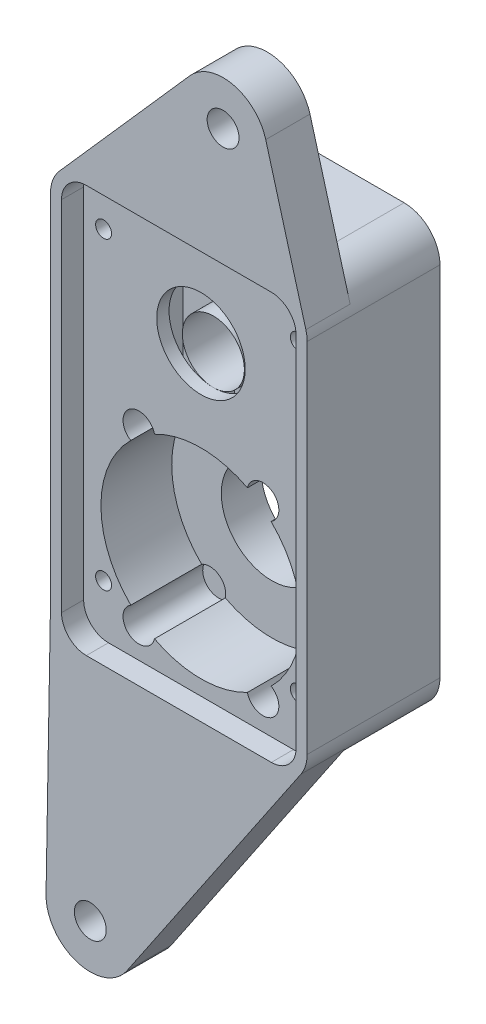
from build123d import *
from build123d.topology import SkipClean

# Parameters (mm, degrees)
SKETCH1_R             = 2.286
SKETCH1_R_2           = 7.239
BOSS_EXTRUDE1_DEPTH   = 6.35
BOSS_EXTRUDE2_START   = 12.7
SKETCH2_R             = 7.239
BOSS_EXTRUDE2_DEPTH   = 12.7
CAVITY1_START         = -6.985
CAVITY1_OUTLINE_R     = 1.143
CAVITY1_OUTLINE_R_2   = 7.239
CAVITY1_OUTLINE_R_3   = 4.445
CAVITY1_DEPTH         = 13.335
CAVITY1_START_2       = 3.175
CAVITY1_2_OUTLINE_R   = 1.143
CAVITY1_2_OUTLINE_R_2 = 4.445
CAVITY1_2_DEPTH       = 3.175
CAVITY1_START_3       = -10.033
CAVITY1_3_OUTLINE_R   = 1.143
CAVITY1_3_OUTLINE_R_2 = 4.445
CAVITY1_3_DEPTH       = 3.048
CAVITY1_START_4       = -12.7
CAVITY1_4_OUTLINE_R   = 1.905
CAVITY1_4_DEPTH       = 3.683
CAVITY1_START_5       = 1.397
CAVITY1_5_DEPTH       = 1.778
CAVITY1_START_6       = -8.255
CAVITY1_6_OUTLINE_R   = 2.286
CAVITY1_6_DEPTH       = 1.27
CAVITY1_START_7       = -10.287
CAVITY1_7_DEPTH       = 0.254


# Read off the part's stored shape, not the designer's step: Cavity1
with BuildPart() as part:
    # Sketch1 → Boss-Extrude1 (new body)
    with BuildSketch(Plane.XY):
        with BuildLine():
            Line((-6.349022038, 0.111441268), (-5.715, 36.232888497))
            Line((-5.715, 36.232888497), (-5.715, 87.540888497))
            ThreePointArc((-5.715, 87.540888497), (-5.382473587, 89.360263498), (-4.427889902, 90.944393921))
            Line((-4.427889902, 90.944393921), (14.289024812, 112.151858549))
            ThreePointArc((14.289024812, 112.151858549), (20.473363243, 114.138419595), (25.168329583, 109.649571449))
            Line((25.168329583, 109.649571449), (30.927346962, 88.917541371))
            ThreePointArc((30.927346962, 88.917541371), (31.067870822, 88.235580298), (31.115, 87.540888497))
            Line((31.115, 87.540888497), (31.115, 36.232888497))
            ThreePointArc((31.115, 36.232888497), (30.889177857, 34.725560815), (30.231540589, 33.350589687))
            Line((30.231540589, 33.350589687), (5.259309369, -3.558393593))
            ThreePointArc((5.259309369, -3.558393593), (-1.914103028, -6.054643639), (-6.349022038, 0.111441268))
        make_face()
        Circle(SKETCH1_R, mode=Mode.SUBTRACT)
        with Locations((19.05, 107.95)):
            Circle(SKETCH1_R, mode=Mode.SUBTRACT)
        with Locations((12.7, 49.186888497)):
            Circle(SKETCH1_R_2, mode=Mode.SUBTRACT)
    extrude(amount=BOSS_EXTRUDE1_DEPTH)

    # Sketch2 → Boss-Extrude2 (add)
    with SkipClean():  # the faces are left unmerged after this step: merging them gives an invalid solid
        with BuildSketch(Plane(origin=(0, 0, 0), x_dir=(-1, 0, 0), z_dir=(0, 0, -1)).offset(BOSS_EXTRUDE2_START)):
            with BuildLine():
                Line((-31.115, 36.232888497), (-31.115, 87.540888497))
                ThreePointArc((-31.115, 87.540888497), (-29.608503729, 91.177892226), (-25.9715, 92.684388497))
                Line((-25.9715, 92.684388497), (0.5715, 92.684388497))
                ThreePointArc((0.5715, 92.684388497), (4.208503729, 91.177892226), (5.715, 87.540888497))
                Line((5.715, 87.540888497), (5.715, 36.232888497))
                ThreePointArc((5.715, 36.232888497), (4.208503729, 32.595884768), (0.5715, 31.089388497))
                Line((0.5715, 31.089388497), (-25.9715, 31.089388497))
                ThreePointArc((-25.9715, 31.089388497), (-29.608503729, 32.595884768), (-31.115, 36.232888497))
            make_face()
            with Locations((-12.7, 49.186888497)):
                Circle(SKETCH2_R, mode=Mode.SUBTRACT)
        extrude(amount=-BOSS_EXTRUDE2_DEPTH)

    # Cavity1 outline → Cavity1 (cut)
    # profile 1 of 6: a face of its own
    with BuildSketch(Plane.XY.offset(CAVITY1_START)):
        with Locations((26.67, 40.042888497)):
            Circle(CAVITY1_OUTLINE_R)
    # profile 2 of 6: a face of its own
    with BuildSketch(Plane.XY.offset(CAVITY1_START)):
        with BuildLine():
            ThreePointArc((22.764128852, 38.956320993), (27.051, 49.186888497), (22.764128852, 59.417456))
            ThreePointArc((22.764128852, 59.417456), (22.936847552, 63.225993711), (19.363505747, 61.897077015))
            ThreePointArc((19.363505747, 61.897077015), (12.7, 63.537888497), (6.036494253, 61.897077015))
            ThreePointArc((6.036494253, 61.897077015), (2.463152448, 63.225993711), (2.635871148, 59.417456))
            ThreePointArc((2.635871148, 59.417456), (-1.651, 49.186888497), (2.635871148, 38.956320993))
            ThreePointArc((2.635871148, 38.956320993), (2.463152448, 35.147783283), (6.036494253, 36.476699979))
            ThreePointArc((6.036494253, 36.476699979), (12.7, 34.835888497), (19.363505747, 36.476699979))
            ThreePointArc((19.363505747, 36.476699979), (22.936847552, 35.147783283), (22.764128852, 38.956320993))
        make_face()
        with Locations((12.7, 49.186888497)):
            Circle(CAVITY1_OUTLINE_R_2, mode=Mode.SUBTRACT)
    # profile 3 of 6: a face of its own
    with BuildSketch(Plane.XY.offset(CAVITY1_START)):
        with Locations((26.67, 83.730888497)):
            Circle(CAVITY1_OUTLINE_R)
    # profile 4 of 6: a face of its own
    with BuildSketch(Plane.XY.offset(CAVITY1_START)):
        with Locations((12.7, 74.586888497)):
            Circle(CAVITY1_OUTLINE_R_3)
    # profile 5 of 6: a face of its own
    with BuildSketch(Plane.XY.offset(CAVITY1_START)):
        with Locations((-1.27, 40.042888497)):
            Circle(CAVITY1_OUTLINE_R)
    # profile 6 of 6: a face of its own
    with BuildSketch(Plane.XY.offset(CAVITY1_START)):
        with Locations((-1.27, 83.730888497)):
            Circle(CAVITY1_OUTLINE_R)
    extrude(amount=CAVITY1_DEPTH, mode=Mode.SUBTRACT)

    # Cavity1 2 outline → Cavity1 2 (cut)
    with BuildSketch(Plane.XY.offset(CAVITY1_START_2)):
        with BuildLine():
            Line((29.5275, 36.232888497), (29.5275, 87.540888497))
            ThreePointArc((29.5275, 87.540888497), (28.485971714, 90.055360211), (25.9715, 91.096888497))
            Line((25.9715, 91.096888497), (-0.5715, 91.096888497))
            ThreePointArc((-0.5715, 91.096888497), (-3.085971714, 90.055360211), (-4.1275, 87.540888497))
            Line((-4.1275, 87.540888497), (-4.1275, 36.232888497))
            ThreePointArc((-4.1275, 36.232888497), (-3.085971714, 33.718416783), (-0.5715, 32.676888497))
            Line((-0.5715, 32.676888497), (25.9715, 32.676888497))
            ThreePointArc((25.9715, 32.676888497), (28.485971714, 33.718416783), (29.5275, 36.232888497))
        make_face()
        with Locations((26.67, 40.042888497)):
            Circle(CAVITY1_2_OUTLINE_R, mode=Mode.SUBTRACT)
        with BuildLine():
            ThreePointArc((19.363505747, 36.476699979), (12.7, 34.835888497), (6.036494253, 36.476699979))
            ThreePointArc((6.036494253, 36.476699979), (2.463152448, 35.147783283), (2.635871148, 38.956320993))
            ThreePointArc((2.635871148, 38.956320993), (-1.651, 49.186888497), (2.635871148, 59.417456))
            ThreePointArc((2.635871148, 59.417456), (2.463152448, 63.225993711), (6.036494253, 61.897077015))
            ThreePointArc((6.036494253, 61.897077015), (12.7, 63.537888497), (19.363505747, 61.897077015))
            ThreePointArc((19.363505747, 61.897077015), (22.936847552, 63.225993711), (22.764128852, 59.417456))
            ThreePointArc((22.764128852, 59.417456), (27.051, 49.186888497), (22.764128852, 38.956320993))
            ThreePointArc((22.764128852, 38.956320993), (22.936847552, 35.147783283), (19.363505747, 36.476699979))
        make_face(mode=Mode.SUBTRACT)
        with Locations((12.7, 74.586888497)):
            Circle(CAVITY1_2_OUTLINE_R_2, mode=Mode.SUBTRACT)
        with Locations((26.67, 83.730888497)):
            Circle(CAVITY1_2_OUTLINE_R, mode=Mode.SUBTRACT)
        with Locations((-1.27, 40.042888497)):
            Circle(CAVITY1_2_OUTLINE_R, mode=Mode.SUBTRACT)
        with Locations((-1.27, 83.730888497)):
            Circle(CAVITY1_2_OUTLINE_R, mode=Mode.SUBTRACT)
    extrude(amount=CAVITY1_2_DEPTH, mode=Mode.SUBTRACT)

    # Cavity1 3 outline → Cavity1 3 (cut)
    with BuildSketch(Plane.XY.offset(CAVITY1_START_3)):
        with Locations((26.67, 40.042888497)):
            Circle(CAVITY1_3_OUTLINE_R)
        with Locations((26.67, 83.730888497)):
            Circle(CAVITY1_3_OUTLINE_R)
        with BuildLine():
            ThreePointArc((9.07956216, 63.073703497), (12.7, 58.076888497), (16.32043784, 63.073703497))
            ThreePointArc((16.32043784, 63.073703497), (12.7, 63.537888497), (9.07956216, 63.073703497))
        make_face()
        with Locations((12.7, 74.586888497)):
            Circle(CAVITY1_3_OUTLINE_R_2)
        with Locations((-1.27, 40.042888497)):
            Circle(CAVITY1_3_OUTLINE_R)
        with Locations((-1.27, 83.730888497)):
            Circle(CAVITY1_3_OUTLINE_R)
    extrude(amount=CAVITY1_3_DEPTH, mode=Mode.SUBTRACT)

    # Cavity1 4 outline → Cavity1 4 (cut)
    with BuildSketch(Plane.XY.offset(CAVITY1_START_4)):
        with Locations((26.67, 40.042888497)):
            Circle(CAVITY1_4_OUTLINE_R)
        with Locations((26.67, 83.730888497)):
            Circle(CAVITY1_4_OUTLINE_R)
        with Locations((-1.27, 40.042888497)):
            Circle(CAVITY1_4_OUTLINE_R)
        with Locations((-1.27, 83.730888497)):
            Circle(CAVITY1_4_OUTLINE_R)
    extrude(amount=CAVITY1_4_DEPTH, mode=Mode.SUBTRACT)

    # Cavity1 5 outline → Cavity1 5 (cut)
    with BuildSketch(Plane.XY.offset(CAVITY1_START_5)):
        with BuildLine():
            Line((17.028512749, 73.575947162), (18.969761763, 75.485614461))
            ThreePointArc((18.969761763, 75.485614461), (19.029908656, 75.987154505), (19.05, 76.491888497))
            ThreePointArc((19.05, 76.491888497), (18.05067461, 79.911359394), (15.367234262, 82.254558138))
            Line((15.367234262, 82.254558138), (14.222653339, 78.762957439))
            ThreePointArc((14.222653339, 78.762957439), (16.341855234, 77.135400897), (17.145, 74.586888497))
            ThreePointArc((17.145, 74.586888497), (17.11578216, 74.078073289), (17.028512749, 73.575947162))
        make_face()
        with BuildLine():
            ThreePointArc((13.961900971, 70.268536833), (17.281043618, 72.094555286), (18.969761763, 75.485614461))
            Line((18.969761763, 75.485614461), (17.028512749, 73.575947162))
            ThreePointArc((17.028512749, 73.575947162), (15.927510814, 71.530550992), (13.945086436, 70.319830404))
            Line((13.945086436, 70.319830404), (13.961900971, 70.268536833))
        make_face()
        with BuildLine():
            Line((14.222653339, 78.762957439), (15.367234262, 82.254558138))
            ThreePointArc((15.367234262, 82.254558138), (12.7, 82.841888497), (10.032765738, 82.254558138))
            Line((10.032765738, 82.254558138), (11.177346661, 78.762957439))
            ThreePointArc((11.177346661, 78.762957439), (12.7, 79.031888497), (14.222653339, 78.762957439))
        make_face()
        with BuildLine():
            ThreePointArc((13.603307828, 70.206466079), (13.783049159, 70.234932007), (13.961900971, 70.268536833))
            Line((13.961900971, 70.268536833), (13.945086436, 70.319830404))
            ThreePointArc((13.945086436, 70.319830404), (13.793135953, 70.278399343), (13.639813077, 70.242377434))
            Line((13.639813077, 70.242377434), (13.603307828, 70.206466079))
        make_face()
        with BuildLine():
            Line((11.177346661, 78.762957439), (10.032765738, 82.254558138))
            ThreePointArc((10.032765738, 82.254558138), (7.094455948, 79.475238273), (6.430238237, 75.485614461))
            Line((6.430238237, 75.485614461), (8.371487251, 73.575947162))
            ThreePointArc((8.371487251, 73.575947162), (8.790357427, 76.701769096), (11.177346661, 78.762957439))
        make_face()
        with BuildLine():
            ThreePointArc((12.6999999, 70.141888497), (13.152806558, 70.158053464), (13.603307828, 70.206466079))
            Line((13.603307828, 70.206466079), (13.639813077, 70.242377434))
            ThreePointArc((13.639813077, 70.242377434), (13.172585034, 70.167082123), (12.6999999, 70.141888497))
        make_face()
        with BuildLine():
            Line((11.760186923, 70.242377434), (11.796692172, 70.206466079))
            ThreePointArc((11.796692172, 70.206466079), (12.247193343, 70.158053471), (12.6999999, 70.141888497))
            ThreePointArc((12.6999999, 70.141888497), (12.227414866, 70.167082133), (11.760186923, 70.242377434))
        make_face()
        with BuildLine():
            ThreePointArc((11.438099029, 70.268536833), (11.616950841, 70.234932007), (11.796692172, 70.206466079))
            Line((11.796692172, 70.206466079), (11.760186923, 70.242377434))
            ThreePointArc((11.760186923, 70.242377434), (11.606864047, 70.278399343), (11.454913564, 70.319830404))
            Line((11.454913564, 70.319830404), (11.438099029, 70.268536833))
        make_face()
        with BuildLine():
            ThreePointArc((6.430238237, 75.485614461), (8.118956382, 72.094555286), (11.438099029, 70.268536833))
            Line((11.438099029, 70.268536833), (11.454913564, 70.319830404))
            ThreePointArc((11.454913564, 70.319830404), (9.472489186, 71.530550992), (8.371487251, 73.575947162))
            Line((8.371487251, 73.575947162), (6.430238237, 75.485614461))
        make_face()
    extrude(amount=CAVITY1_5_DEPTH, mode=Mode.SUBTRACT)

    # Cavity1 6 outline → Cavity1 6 (cut)
    with BuildSketch(Plane.XY.offset(CAVITY1_START_6)):
        with Locations((21.59, 36.994888497)):
            Circle(CAVITY1_6_OUTLINE_R)
        with Locations((21.59, 61.378888497)):
            Circle(CAVITY1_6_OUTLINE_R)
        with Locations((3.81, 36.994888497)):
            Circle(CAVITY1_6_OUTLINE_R)
        with Locations((3.81, 61.378888497)):
            Circle(CAVITY1_6_OUTLINE_R)
    extrude(amount=CAVITY1_6_DEPTH, mode=Mode.SUBTRACT)

    # Cavity1 7 outline → Cavity1 7 (cut)
    with BuildSketch(Plane.XY.offset(CAVITY1_START_7)):
        with BuildLine():
            ThreePointArc((9.07956216, 63.073703497), (12.7, 58.076888497), (16.32043784, 63.073703497))
            ThreePointArc((16.32043784, 63.073703497), (12.7, 63.537888497), (9.07956216, 63.073703497))
        make_face()
    extrude(amount=CAVITY1_7_DEPTH, mode=Mode.SUBTRACT)


solid = part.part
